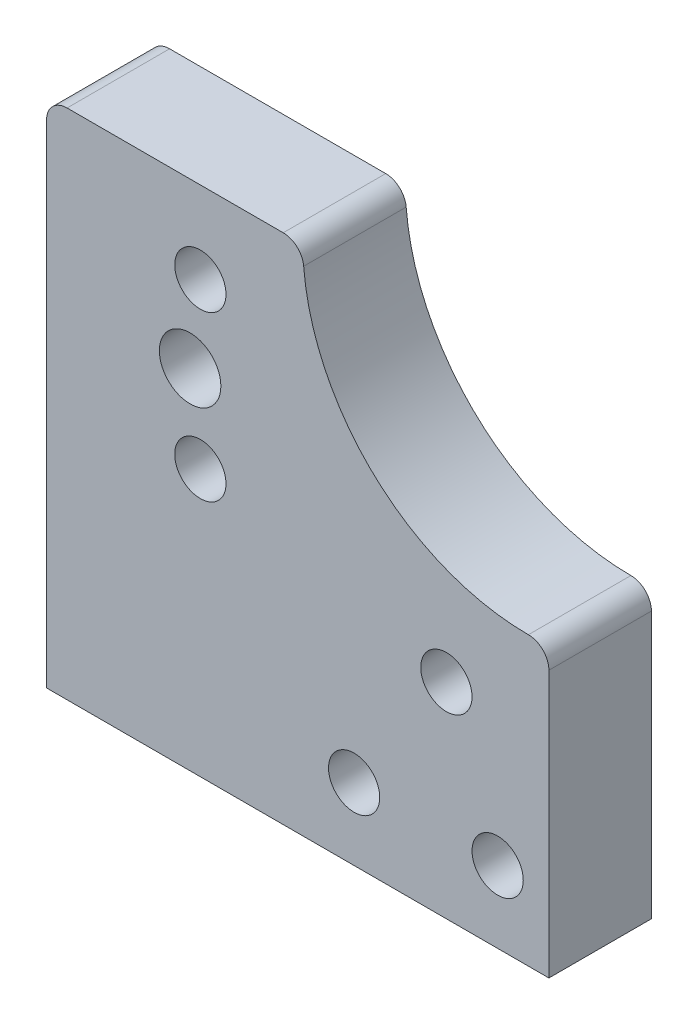
from build123d import *

# Parameters (mm, degrees)
SKETCH1_R                   = 1.5
BOSS_EXTRUDE1_DEPTH         = 5
TAP_DRILL_FOR_M3_TAP1_D     = 2.5
TAP_DRILL_FOR_M3_TAP2_D     = 2.5
TAP_DRILL_FOR_M3_TAP2_DEPTH = 4
TAP_DRILL_FOR_M3_TAP2_TIP   = 0.751075774
FILLET1_R                   = 1


with BuildPart() as part:
    # Sketch1 → Boss-Extrude1 (new body)
    with BuildSketch(Plane.XY):
        with BuildLine():
            Line((-10, 25), (-2, 25))
            ThreePointArc((-2, 25), (1.221825407, 17.221825407), (9, 14))
            Line((9, 14), (10, 14))
            Line((10, 14), (10, 0.5))
            Line((10, 0.5), (10, 0))
            Line((10, 0), (-10, 0))
            Line((-10, 0), (-14.5, 0))
            Line((-14.5, 0), (-14.5, 25))
            Line((-14.5, 25), (-10, 25))
        make_face()
        with Locations((-7.5, 17)):
            Circle(SKETCH1_R, mode=Mode.SUBTRACT)
    extrude(amount=BOSS_EXTRUDE1_DEPTH)

    # Tap Drill for M3 Tap1 (through all)
    with Locations(Plane.XY.offset(5)):
        with Locations((-7, 13), (-7, 21), (5, 10), (0.5, 3.5), (7.5, 3.5)):
            Hole(TAP_DRILL_FOR_M3_TAP1_D / 2)

    # Tap Drill for M3 Tap2
    with Locations(Plane(origin=(0, 0, 0), x_dir=(-1, 0, 0), z_dir=(0, -1, 0))):
        with Locations((3.75, -2.5), (10.25, -2.5)):
            Hole(TAP_DRILL_FOR_M3_TAP2_D / 2, depth=TAP_DRILL_FOR_M3_TAP2_DEPTH)
            with Locations((0, 0, -(TAP_DRILL_FOR_M3_TAP2_DEPTH + TAP_DRILL_FOR_M3_TAP2_TIP / 2))):  # 118° drill point
                Cone(0, TAP_DRILL_FOR_M3_TAP2_D / 2, TAP_DRILL_FOR_M3_TAP2_TIP, mode=Mode.SUBTRACT)

    # Fillet1
    fillet1_edges = [part.edges().sort_by_distance(p)[0] for p in [
        (-14.5, 25, 2.5),
        (-2, 25, 2.5),
        (10, 14, 2.5),
    ]]
    fillet(fillet1_edges, radius=FILLET1_R - 0.0001)  # a hair under: the kernel refuses the full size


solid = part.part
